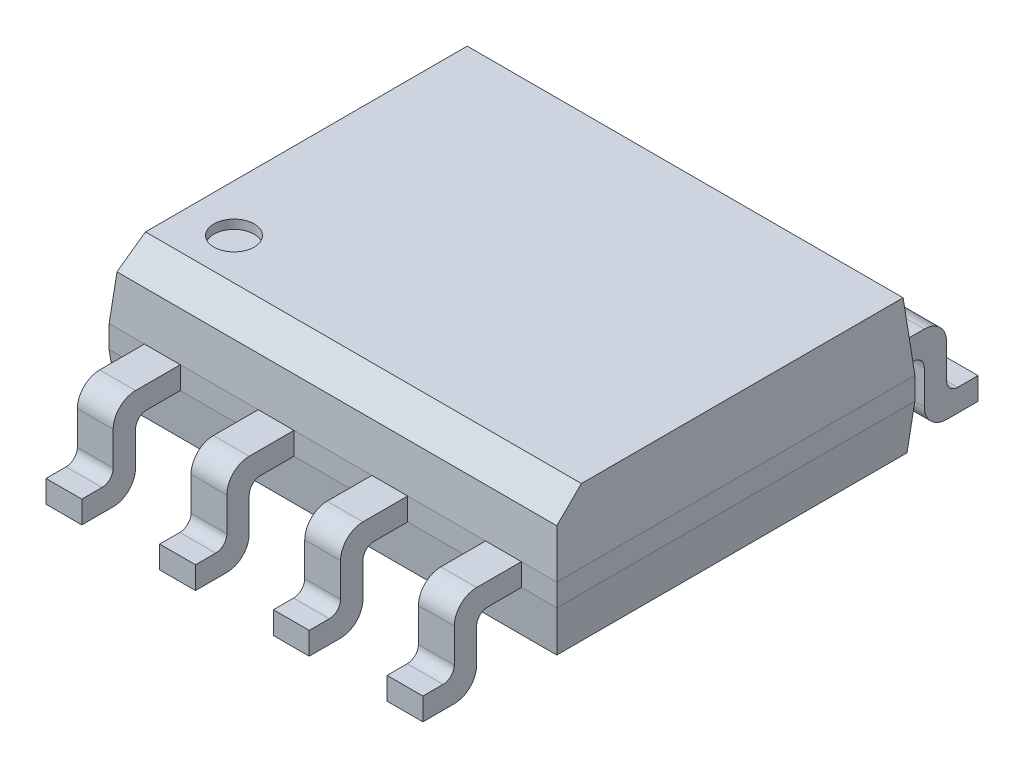
from build123d import *

# Parameters (mm, degrees)
SKETCH2_W            = 5
SKETCH2_H            = 4
PACKAGE_DEPTH        = 1.5
DRAFT1_START         = -2.5
DRAFT1_DEPTH         = 5
DRAFT1_START_2       = -3
DRAFT1_2_DEPTH       = 6
DRAFT2_START         = -2
DRAFT2_DEPTH         = 4
DRAFT2_START_2       = -3
DRAFT2_2_DEPTH       = 6
CHAMFER1_SIZE        = 0.25
CHAMFER1_SIZE2       = 0.275015717
LEADS_DEPTH          = 0.2
FILLET1_R            = 0.25
FILLET2_R            = 0.125
FILLET1_OF_MIRROR1_R = 0.25
FILLET2_OF_MIRROR1_R = 0.125
LPATTERN1_START      = -0.835
LPATTERN1_DEPTH      = 0.4
LPATTERN1_START_2    = 0.435
LPATTERN1_2_DEPTH    = 0.4
LPATTERN1_START_3    = 1.705
LPATTERN1_3_DEPTH    = 0.4
SKETCH4_R            = 0.225
MARKER_DEPTH         = 0.1


with BuildPart() as part:
    # Sketch2 → Package (new body)
    with BuildSketch(Plane(origin=(0, 0.25, 0), x_dir=(-1, 0, 0), z_dir=(0, 1, 0))):
        Rectangle(SKETCH2_W, SKETCH2_H)
    extrude(amount=PACKAGE_DEPTH)

    # Draft1: read off the stored shape, not the designer's step
    # Draft1 outline → Draft1 (cut)
    with BuildSketch(Plane.YZ.offset(DRAFT1_START)):
        Polygon((1.75, -2), (1.75, -1.934383502), (1, -2), align=None)
        Polygon((1, 2), (1.75, 1.934383502), (1.75, 2), align=None)
    extrude(amount=DRAFT1_DEPTH, mode=Mode.SUBTRACT)

    # Draft1 2 outline → Draft1 2 (cut)
    with BuildSketch(Plane.XY.offset(DRAFT1_START_2)):
        Polygon((-2.5, 1), (-2.434383502, 1.75), (-2.5, 1.75), align=None)
        Polygon((2.434383502, 1.75), (2.5, 1), (2.5, 1.75), align=None)
    extrude(amount=DRAFT1_2_DEPTH, mode=Mode.SUBTRACT)

    # Draft2: read off the stored shape, not the designer's step
    # Draft2 outline → Draft2 (cut)
    with BuildSketch(Plane.XY.offset(DRAFT2_START)):
        Polygon((2.5, 0.75), (2.456255668, 0.25), (2.5, 0.25), align=None)
        Polygon((-2.456255668, 0.25), (-2.5, 0.75), (-2.5, 0.25), align=None)
    extrude(amount=DRAFT2_DEPTH, mode=Mode.SUBTRACT)

    # Draft2 2 outline → Draft2 2 (cut)
    with BuildSketch(Plane.YZ.offset(DRAFT2_START_2)):
        Polygon((0.75, -2), (0.25, -1.956255668), (0.25, -2), align=None)
        Polygon((0.25, 1.956255668), (0.75, 2), (0.25, 2), align=None)
    extrude(amount=DRAFT2_2_DEPTH, mode=Mode.SUBTRACT)

    # Chamfer1
    chamfer1_edges = [part.edges().sort_by_distance(p)[0] for p in [
        (0, 1.75, 1.934383502),
    ]]
    chamfer1_side = [part.faces().sort_by_distance(p)[0] for p in [
        (0, 1.373337774, 1.967337177),
    ]]
    chamfer(chamfer1_edges, length=CHAMFER1_SIZE, length2=CHAMFER1_SIZE2, reference=chamfer1_side[0])

    # Sketch3 → Leads (add, symmetric)
    with BuildSketch(Plane.ZY.offset(1.905)):
        Polygon((-2, 1), (-2, 0.75), (2.5, 0.75), (2.5, 0), (3.1, 0), (3.1, 0.25), (2.75, 0.25), (2.75, 1), align=None)
    leads = extrude(amount=LEADS_DEPTH, both=True)

    # Fillet1
    fillet1_edges = [part.edges().sort_by_distance(p)[0] for p in [
        (-1.905, 1, 2.75),
        (-1.905, 0, 2.5),
    ]]
    fillet(fillet1_edges, radius=FILLET1_R)

    # Fillet2
    fillet2_edges = [part.edges().sort_by_distance(p)[0] for p in [
        (-1.905, 0.75, 2.5),
        (-1.905, 0.25, 2.75),
    ]]
    fillet(fillet2_edges, radius=FILLET2_R)

    # Mirror1: Leads across plane
    add(leads.mirror(Plane.XY))

    # Fillet1 of Mirror1
    fillet1_of_mirror1_edges = [part.edges().sort_by_distance(p)[0] for p in [
        (-1.905, 1, -2.75),
        (-1.905, 0, -2.5),
    ]]
    fillet(fillet1_of_mirror1_edges, radius=FILLET1_OF_MIRROR1_R)

    # Fillet2 of Mirror1
    fillet2_of_mirror1_edges = [part.edges().sort_by_distance(p)[0] for p in [
        (-1.905, 0.75, -2.5),
        (-1.905, 0.25, -2.75),
    ]]
    fillet(fillet2_of_mirror1_edges, radius=FILLET2_OF_MIRROR1_R)

    # LPattern1: read off the stored shape, not the designer's step
    # LPattern1 outline → LPattern1 (add)
    with BuildSketch(Plane.YZ.offset(LPATTERN1_START)):
        with BuildLine():
            Line((1, 2), (1, 2.5))
            ThreePointArc((1, 2.5), (0.926776695, 2.676776695), (0.75, 2.75))
            Line((0.75, 2.75), (0.375, 2.75))
            ThreePointArc((0.375, 2.75), (0.286611652, 2.786611652), (0.25, 2.875))
            Line((0.25, 2.875), (0.25, 3.1))
            Line((0.25, 3.1), (0, 3.1))
            Line((0, 3.1), (0, 2.75))
            ThreePointArc((0, 2.75), (0.073223305, 2.573223305), (0.25, 2.5))
            Line((0.25, 2.5), (0.625, 2.5))
            ThreePointArc((0.625, 2.5), (0.713388348, 2.463388348), (0.75, 2.375))
            Line((0.75, 2.375), (0.75, 2))
            Line((0.75, 2), (1, 2))
        make_face()
        with BuildLine():
            ThreePointArc((0.75, -2.75), (0.926776695, -2.676776695), (1, -2.5))
            Line((1, -2.5), (1, -2))
            Line((1, -2), (0.75, -2))
            Line((0.75, -2), (0.75, -2.375))
            ThreePointArc((0.75, -2.375), (0.713388348, -2.463388348), (0.625, -2.5))
            Line((0.625, -2.5), (0.25, -2.5))
            ThreePointArc((0.25, -2.5), (0.073223305, -2.573223305), (0, -2.75))
            Line((0, -2.75), (0, -3.1))
            Line((0, -3.1), (0.25, -3.1))
            Line((0.25, -3.1), (0.25, -2.875))
            ThreePointArc((0.25, -2.875), (0.286611652, -2.786611652), (0.375, -2.75))
            Line((0.375, -2.75), (0.75, -2.75))
        make_face()
    extrude(amount=LPATTERN1_DEPTH)

    # LPattern1 2 outline → LPattern1 2 (add)
    with BuildSketch(Plane.YZ.offset(LPATTERN1_START_2)):
        with BuildLine():
            Line((1, 2), (1, 2.5))
            ThreePointArc((1, 2.5), (0.926776695, 2.676776695), (0.75, 2.75))
            Line((0.75, 2.75), (0.375, 2.75))
            ThreePointArc((0.375, 2.75), (0.286611652, 2.786611652), (0.25, 2.875))
            Line((0.25, 2.875), (0.25, 3.1))
            Line((0.25, 3.1), (0, 3.1))
            Line((0, 3.1), (0, 2.75))
            ThreePointArc((0, 2.75), (0.073223305, 2.573223305), (0.25, 2.5))
            Line((0.25, 2.5), (0.625, 2.5))
            ThreePointArc((0.625, 2.5), (0.713388348, 2.463388348), (0.75, 2.375))
            Line((0.75, 2.375), (0.75, 2))
            Line((0.75, 2), (1, 2))
        make_face()
        with BuildLine():
            ThreePointArc((0.75, -2.75), (0.926776695, -2.676776695), (1, -2.5))
            Line((1, -2.5), (1, -2))
            Line((1, -2), (0.75, -2))
            Line((0.75, -2), (0.75, -2.375))
            ThreePointArc((0.75, -2.375), (0.713388348, -2.463388348), (0.625, -2.5))
            Line((0.625, -2.5), (0.25, -2.5))
            ThreePointArc((0.25, -2.5), (0.073223305, -2.573223305), (0, -2.75))
            Line((0, -2.75), (0, -3.1))
            Line((0, -3.1), (0.25, -3.1))
            Line((0.25, -3.1), (0.25, -2.875))
            ThreePointArc((0.25, -2.875), (0.286611652, -2.786611652), (0.375, -2.75))
            Line((0.375, -2.75), (0.75, -2.75))
        make_face()
    extrude(amount=LPATTERN1_2_DEPTH)

    # LPattern1 3 outline → LPattern1 3 (add)
    with BuildSketch(Plane.YZ.offset(LPATTERN1_START_3)):
        with BuildLine():
            Line((1, 2), (1, 2.5))
            ThreePointArc((1, 2.5), (0.926776695, 2.676776695), (0.75, 2.75))
            Line((0.75, 2.75), (0.375, 2.75))
            ThreePointArc((0.375, 2.75), (0.286611652, 2.786611652), (0.25, 2.875))
            Line((0.25, 2.875), (0.25, 3.1))
            Line((0.25, 3.1), (0, 3.1))
            Line((0, 3.1), (0, 2.75))
            ThreePointArc((0, 2.75), (0.073223305, 2.573223305), (0.25, 2.5))
            Line((0.25, 2.5), (0.625, 2.5))
            ThreePointArc((0.625, 2.5), (0.713388348, 2.463388348), (0.75, 2.375))
            Line((0.75, 2.375), (0.75, 2))
            Line((0.75, 2), (1, 2))
        make_face()
        with BuildLine():
            ThreePointArc((0.75, -2.75), (0.926776695, -2.676776695), (1, -2.5))
            Line((1, -2.5), (1, -2))
            Line((1, -2), (0.75, -2))
            Line((0.75, -2), (0.75, -2.375))
            ThreePointArc((0.75, -2.375), (0.713388348, -2.463388348), (0.625, -2.5))
            Line((0.625, -2.5), (0.25, -2.5))
            ThreePointArc((0.25, -2.5), (0.073223305, -2.573223305), (0, -2.75))
            Line((0, -2.75), (0, -3.1))
            Line((0, -3.1), (0.25, -3.1))
            Line((0.25, -3.1), (0.25, -2.875))
            ThreePointArc((0.25, -2.875), (0.286611652, -2.786611652), (0.375, -2.75))
            Line((0.375, -2.75), (0.75, -2.75))
        make_face()
    extrude(amount=LPATTERN1_3_DEPTH)

    # Sketch4 → Marker (cut)
    with BuildSketch(Plane(origin=(0, 1.75, 0), x_dir=(1, 0, 0), z_dir=(0, 1, 0))):
        with Locations(Location((-1.905, -1.2, 0), (0, 0, 270))):
            Circle(SKETCH4_R)
    extrude(amount=-MARKER_DEPTH, mode=Mode.SUBTRACT)


solid = part.part
